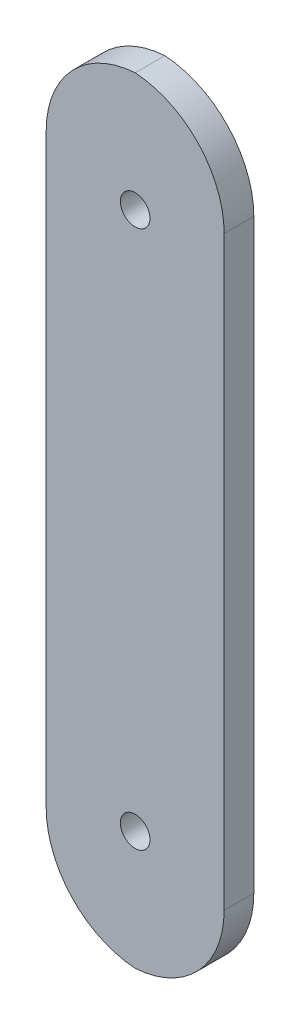
from build123d import *

# Parameters (mm, degrees)
SKETCH2_W           = 19.05
SKETCH2_H           = 83.058
BOSS_EXTRUDE1_DEPTH = 3.175
FILLET1_R           = 10.16
SKETCH3_R           = 1.5875
CUT_EXTRUDE1_DEPTH  = 3.175


with BuildPart() as part:
    # Sketch2 → Boss-Extrude1 (new body)
    with BuildSketch(Plane.XY):
        with Locations((-9.525, 41.529)):
            Rectangle(SKETCH2_W, SKETCH2_H)
    extrude(amount=BOSS_EXTRUDE1_DEPTH)

    # Fillet1
    # the kernel refuses this fillet: 10.16 mm, written as the material it takes off along each edge
    with BuildSketch(Plane(origin=(-19.05, 0, -25.4), x_dir=(1, 0, 0), z_dir=(0, 0, 1)), Plane(origin=(-19.05, 83.058, -25.4), x_dir=(0, -1, 0), z_dir=(0, 0, 1)), Plane(origin=(0, 83.058, -25.4), x_dir=(-1, 0, 0), z_dir=(0, 0, 1))) as fillet1_piece_1:
        with BuildLine():
            CenterArc((FILLET1_R, FILLET1_R), FILLET1_R, 180, 90)
            Line((0, FILLET1_R), (0, 0))
            Line((0, 0), (FILLET1_R, 0))
        make_face()
    extrude(amount=53.975, mode=Mode.SUBTRACT)
    with BuildSketch(Plane(origin=(0, 0, -25.4), x_dir=(-1, 0, 0), z_dir=(0, 0, 1))) as fillet1_piece_2:
        with BuildLine():
            CenterArc((FILLET1_R, -FILLET1_R), FILLET1_R, 90, 90)
            Line((0, -FILLET1_R), (0, 0))
            Line((0, 0), (FILLET1_R, 0))
        make_face()
    extrude(amount=53.975, mode=Mode.SUBTRACT)

    # Sketch3 → Cut-Extrude1 (cut)
    with BuildSketch(Plane.XY.offset(3.175)):
        with Locations((-9.525, 12.719863167)):
            Circle(SKETCH3_R)
        with Locations((-9.525, 70.338136833)):
            Circle(SKETCH3_R)
    extrude(amount=-CUT_EXTRUDE1_DEPTH, mode=Mode.SUBTRACT)


solid = part.part
